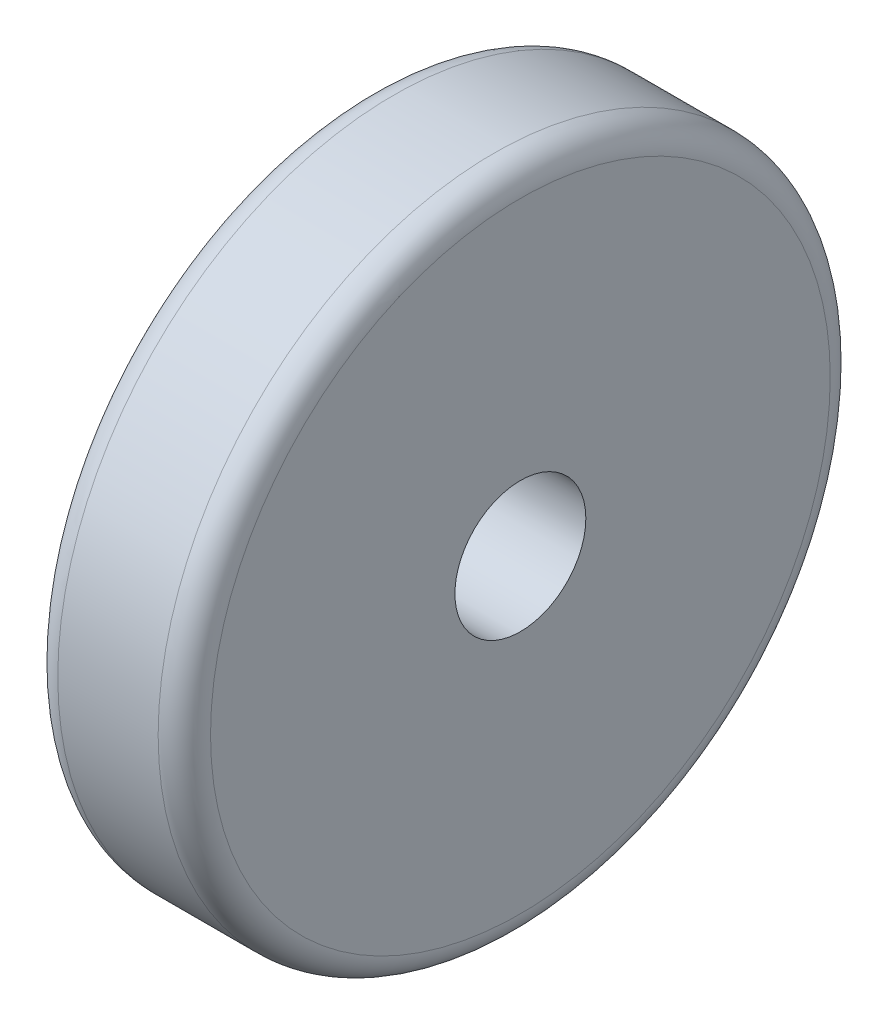
from build123d import *

# Parameters (mm, degrees)
BOSS_EXTRUDE1_START       = -8.75
BOSS_EXTRUDE1_OUTLINE_R   = 38.498666077
BOSS_EXTRUDE1_OUTLINE_R_2 = 7.5
BOSS_EXTRUDE1_DEPTH       = 17.5
FILLET1_R                 = 3


# Read off the part's stored shape, not the designer's step: Boss-Extrude1
with BuildPart() as part:
    # Boss-Extrude1 outline → Boss-Extrude1 (new body)
    with BuildSketch(Plane.YZ.offset(BOSS_EXTRUDE1_START)):
        Circle(BOSS_EXTRUDE1_OUTLINE_R)
        Circle(BOSS_EXTRUDE1_OUTLINE_R_2, mode=Mode.SUBTRACT)
    extrude(amount=BOSS_EXTRUDE1_DEPTH)

    # Fillet1
    fillet1_edges = [part.edges().sort_by_distance(p)[0] for p in [
        (-8.75, -38.498666077, 0),
        (8.75, -38.498666077, 0),
    ]]
    fillet(fillet1_edges, radius=FILLET1_R)


solid = part.part
